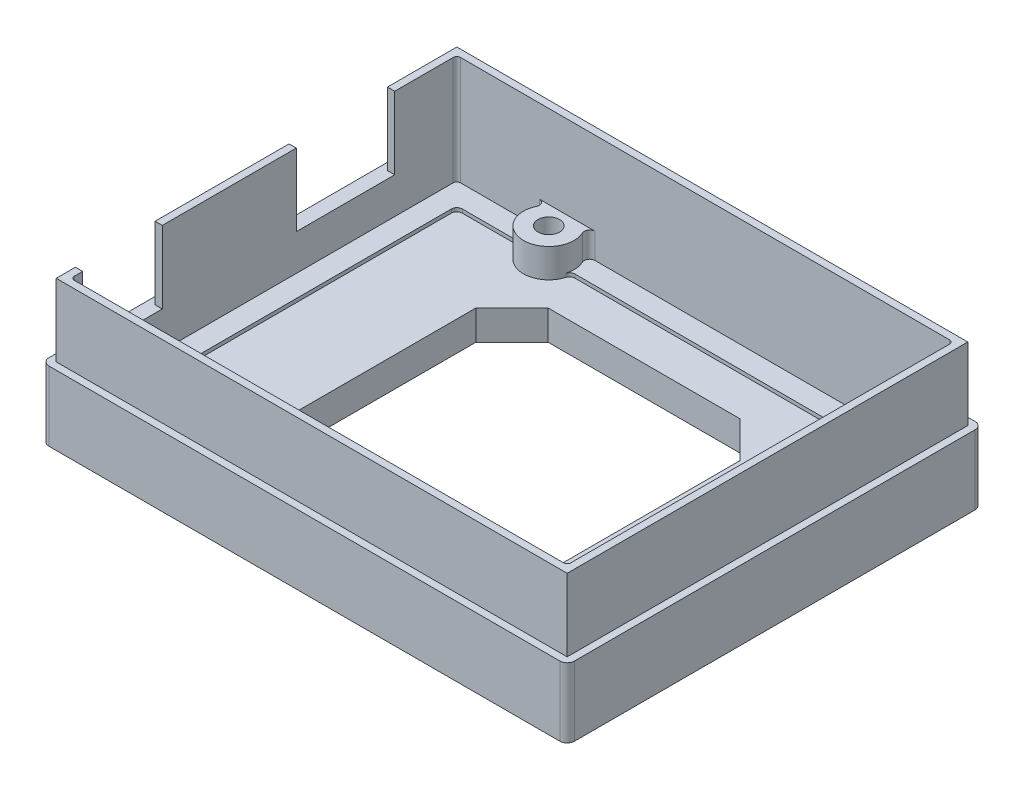
from build123d import *

# Parameters (mm, degrees)
SKETCH1_W                 = 72.58
SKETCH1_H                 = 57.34
SKETCH1_R                 = 1.5
BOSS_EXTRUDE1_DEPTH       = 4.1
SKETCH2_W                 = 72.58
SKETCH2_H                 = 57.34
SKETCH2_R                 = 1.5
BOSS_EXTRUDE2_DEPTH       = 0.5
SKETCH2_4_W               = 72.58
SKETCH2_4_H               = 57.34
SKETCH2_4_R               = 1.5
BOSS_EXTRUDE3_DEPTH       = 4
BOSS_EXTRUDE4_START       = 4
BOSS_EXTRUDE4_OUTLINE_W   = 72.58
BOSS_EXTRUDE4_OUTLINE_H   = 57.34
BOSS_EXTRUDE4_OUTLINE_W_2 = 68.58
BOSS_EXTRUDE4_OUTLINE_H_2 = 53.34
BOSS_EXTRUDE4_DEPTH       = 1.5
SKETCH4_W                 = 70.58
SKETCH4_H                 = 55.34
SKETCH4_W_2               = 68.58
SKETCH4_H_2               = 53.34
BOSS_EXTRUDE5_DEPTH       = 10
FILLET1_R                 = 1
FILLET2_R                 = 0.5
FILLET3_R                 = 0.75
SKETCH3_W                 = 36.5
SKETCH3_H                 = 36.5
CUT_EXTRUDE1_DEPTH        = 51.230399162
SKETCH6_W                 = 11
SKETCH6_H                 = 12
SKETCH6_W_2               = 13.6
SKETCH6_H_2               = 13.6
CUT_EXTRUDE2_DEPTH        = 3
CHAMFER1_SIZE             = 5
SKETCH7_R                 = 3.5
SKETCH7_R_2               = 1.5
CUT_EXTRUDE3_DEPTH        = 3


# Read off the part's stored shape, not the designer's step: Boss-Extrude4
with BuildPart() as part:
    # Sketch1 → Boss-Extrude1 (new body)
    with BuildSketch(Plane(origin=(0, 0, 0), x_dir=(1, 0, 0), z_dir=(0, 1, 0))):
        Rectangle(SKETCH1_W, SKETCH1_H)
        with Locations(Location((-19.05, 24.13, 0), (0, 0, 270))):
            Circle(SKETCH1_R, mode=Mode.SUBTRACT)
        with Locations(Location((31.75, 8.89, 0), (0, 0, 270))):
            Circle(SKETCH1_R, mode=Mode.SUBTRACT)
        with Locations(Location((31.75, -19.05, 0), (0, 0, 270))):
            Circle(SKETCH1_R, mode=Mode.SUBTRACT)
        with Locations(Location((-20.32, -24.13, 0), (0, 0, 270))):
            Circle(SKETCH1_R, mode=Mode.SUBTRACT)
    extrude(amount=BOSS_EXTRUDE1_DEPTH)

    # Sketch2 → Boss-Extrude2 (add)
    with BuildSketch(Plane(origin=(0, 4.1, 0), x_dir=(1, 0, 0), z_dir=(0, 1, 0))):
        Rectangle(SKETCH2_W, SKETCH2_H)
        with BuildLine():
            Line((-31.29, -23.67), (-31.29, 23.67))
            Line((-31.29, 23.67), (-22.519639751, 23.67))
            ThreePointArc((-22.519639751, 23.67), (-19.05, 20.63), (-15.580360249, 23.67))
            Line((-15.580360249, 23.67), (31.29, 23.67))
            Line((31.29, 23.67), (31.29, 12.359639751))
            ThreePointArc((31.29, 12.359639751), (28.25, 8.89), (31.29, 5.420360249))
            Line((31.29, 5.420360249), (31.29, -15.580360249))
            ThreePointArc((31.29, -15.580360249), (28.25, -19.05), (31.29, -22.519639751))
            Line((31.29, -22.519639751), (31.29, -23.67))
            Line((31.29, -23.67), (-16.850360249, -23.67))
            ThreePointArc((-16.850360249, -23.67), (-20.32, -20.63), (-23.789639751, -23.67))
            Line((-23.789639751, -23.67), (-31.29, -23.67))
        make_face(mode=Mode.SUBTRACT)
        with Locations(Location((31.75, 8.89, 0), (0, 0, 270))):
            Circle(SKETCH2_R, mode=Mode.SUBTRACT)
        with Locations(Location((-19.05, 24.13, 0), (0, 0, 270))):
            Circle(SKETCH2_R, mode=Mode.SUBTRACT)
        with Locations(Location((-20.32, -24.13, 0), (0, 0, 270))):
            Circle(SKETCH2_R, mode=Mode.SUBTRACT)
        with Locations(Location((31.75, -19.05, 0), (0, 0, 270))):
            Circle(SKETCH2_R, mode=Mode.SUBTRACT)
    extrude(amount=BOSS_EXTRUDE2_DEPTH)

    # Sketch2<4> → Boss-Extrude3 (add)
    with BuildSketch(Plane(origin=(0, 4.1, 0), x_dir=(1, 0, 0), z_dir=(0, 1, 0))):
        Rectangle(SKETCH2_4_W, SKETCH2_4_H)
        with BuildLine():
            ThreePointArc((-21.457986711, 26.67), (-19.05, 20.63), (-16.642013289, 26.67))
            Line((-16.642013289, 26.67), (34.29, 26.67))
            Line((34.29, 26.67), (34.29, 11.297986711))
            ThreePointArc((34.29, 11.297986711), (28.25, 8.89), (34.29, 6.482013289))
            Line((34.29, 6.482013289), (34.29, -16.642013289))
            ThreePointArc((34.29, -16.642013289), (28.25, -19.05), (34.29, -21.457986711))
            Line((34.29, -21.457986711), (34.29, -26.67))
            Line((34.29, -26.67), (-17.912013289, -26.67))
            ThreePointArc((-17.912013289, -26.67), (-20.32, -20.63), (-22.727986711, -26.67))
            Line((-22.727986711, -26.67), (-34.29, -26.67))
            Line((-34.29, -26.67), (-34.29, 26.67))
            Line((-34.29, 26.67), (-21.457986711, 26.67))
        make_face(mode=Mode.SUBTRACT)
        with Locations(Location((-19.05, 24.13, 0), (0, 0, 270))):
            Circle(SKETCH2_4_R, mode=Mode.SUBTRACT)
        with Locations(Location((-20.32, -24.13, 0), (0, 0, 270))):
            Circle(SKETCH2_4_R, mode=Mode.SUBTRACT)
        with Locations(Location((31.75, -19.05, 0), (0, 0, 270))):
            Circle(SKETCH2_4_R, mode=Mode.SUBTRACT)
        with Locations(Location((31.75, 8.89, 0), (0, 0, 270))):
            Circle(SKETCH2_4_R, mode=Mode.SUBTRACT)
    extrude(amount=BOSS_EXTRUDE3_DEPTH)

    # Boss-Extrude4 outline → Boss-Extrude4 (add)
    with BuildSketch(Plane(origin=(0, 4.1, 0), x_dir=(1, 0, 0), z_dir=(0, 1, 0)).offset(BOSS_EXTRUDE4_START)):
        Rectangle(BOSS_EXTRUDE4_OUTLINE_W, BOSS_EXTRUDE4_OUTLINE_H)
        Rectangle(BOSS_EXTRUDE4_OUTLINE_W_2, BOSS_EXTRUDE4_OUTLINE_H_2, mode=Mode.SUBTRACT)
    extrude(amount=BOSS_EXTRUDE4_DEPTH)

    # Sketch4 → Boss-Extrude5 (add)
    with BuildSketch(Plane(origin=(0, 9.6, 0), x_dir=(1, 0, 0), z_dir=(0, 1, 0))):
        Rectangle(SKETCH4_W, SKETCH4_H)
        Rectangle(SKETCH4_W_2, SKETCH4_H_2, mode=Mode.SUBTRACT)
    extrude(amount=BOSS_EXTRUDE5_DEPTH)

    # Fillet1
    fillet1_edges = [part.edges().sort_by_distance(p)[0] for p in [
        (36.29, 4.8, -28.67),
        (36.29, 4.8, 28.67),
        (-36.29, 4.8, 28.67),
        (-36.29, 4.8, -28.67),
    ]]
    fillet(fillet1_edges, radius=FILLET1_R)

    # Fillet2
    fillet2_edges = [part.edges().sort_by_distance(p)[0] for p in [
        (34.29, 12.1, 26.67),
        (-34.29, 12.1, 26.67),
        (-34.29, 12.1, -26.67),
        (34.29, 12.1, -26.67),
    ]]
    fillet(fillet2_edges, radius=FILLET2_R)

    # Fillet3
    # the kernel refuses this fillet: 0.75 mm, written as the material it adds along each edge
    with BuildSketch(Plane(origin=(-17.912013289, 0.983317982, 26.67), x_dir=(1, 0, 0), z_dir=(0, 1, 0)), Plane(origin=(-21.457986711, 0.983317982, -26.67), x_dir=(-1, 0, 0), z_dir=(0, 1, 0)), Plane(origin=(34.29, 0.983317982, -11.297986711), x_dir=(0, 0, -1), z_dir=(0, 1, 0)), Plane(origin=(34.29, 0.983317982, 16.642013289), x_dir=(0, 0, -1), z_dir=(0, 1, 0))) as fillet3_piece_1:
        with BuildLine():
            CenterArc((1.446672807, 0.75), FILLET3_R, 155.091114703, 114.908885297)
            ThreePointArc((0.766438775, 1.065882353), (0.433642713, 0.496683524), (0, 0))
            Line((0, 0), (1.446672807, 0))
        make_face()
    extrude(amount=7.116682018)
    with BuildSketch(Plane(origin=(-22.727986711, 0.983317982, 26.67), x_dir=(-1, 0, 0), z_dir=(0, 1, 0)), Plane(origin=(-16.642013289, 0.983317982, -26.67), x_dir=(1, 0, 0), z_dir=(0, 1, 0)), Plane(origin=(34.29, 0.983317982, -6.482013289), x_dir=(0, 0, 1), z_dir=(0, 1, 0)), Plane(origin=(34.29, 0.983317982, 21.457986711), x_dir=(0, 0, 1), z_dir=(0, 1, 0))) as fillet3_piece_2:
        with BuildLine():
            CenterArc((1.446672807, -0.75), FILLET3_R, 90, 114.908885297)
            ThreePointArc((0.766438775, -1.065882353), (0.433642713, -0.496683524), (0, 0))
            Line((0, 0), (1.446672807, 0))
        make_face()
    extrude(amount=7.116682018)
    with BuildSketch(Plane(origin=(31.29, 2.225, -23.67), x_dir=(-1, 0, 0), z_dir=(0, 1, 0)), Plane(origin=(31.29, 2.225, 23.67), x_dir=(0, 0, -1), z_dir=(0, 1, 0)), Plane(origin=(-31.29, 2.225, 23.67), x_dir=(1, 0, 0), z_dir=(0, 1, 0)), Plane(origin=(-31.29, 2.225, -23.67), x_dir=(0, 0, 1), z_dir=(0, 1, 0))) as fillet3_piece_3:
        with BuildLine():
            CenterArc((FILLET3_R, FILLET3_R), FILLET3_R, 180, 90)
            Line((0, FILLET3_R), (0, 0))
            Line((0, 0), (FILLET3_R, 0))
        make_face()
    extrude(amount=2.375)
    with BuildSketch(Plane(origin=(31.29, 2.588815876, -12.359639751), x_dir=(-0.977977776437884, 0, 0.20870905297473832), z_dir=(0, 1, 0)), Plane(origin=(31.29, 2.588815876, 15.580360249), x_dir=(-0.9779777764378829, 0, 0.2087090529747441), z_dir=(0, 1, 0)), Plane(origin=(-16.850360249, 2.588815876, 23.67), x_dir=(-0.2087090529747233, 0, -0.9779777764378872), z_dir=(0, 1, 0)), Plane(origin=(-22.519639751, 2.588815876, -23.67), x_dir=(0.20870905297473083, 0, 0.9779777764378856), z_dir=(0, 1, 0))) as fillet3_piece_4:
        with BuildLine():
            CenterArc((0.607324209, -0.747693586), FILLET3_R, 94.494558388, 73.458731432)
            Line((-0.126159123, -0.591161796), (0, 0))
            ThreePointArc((0, 0), (0.274275449, -0.010763267), (0.548550899, 0))
        make_face()
    extrude(amount=2.011184124)
    with BuildSketch(Plane(origin=(31.29, 2.588815876, -5.420360249), x_dir=(-0.9779777764378846, 0, -0.20870905297473547), z_dir=(0, 1, 0)), Plane(origin=(31.29, 2.588815876, 22.519639751), x_dir=(-0.9779777764378821, 0, -0.20870905297474715), z_dir=(0, 1, 0)), Plane(origin=(-23.789639751, 2.588815876, 23.67), x_dir=(0.20870905297472817, 0, -0.9779777764378861), z_dir=(0, 1, 0)), Plane(origin=(-15.580360249, 2.588815876, -23.67), x_dir=(-0.2087090529747233, 0, 0.9779777764378872), z_dir=(0, 1, 0))) as fillet3_piece_5:
        with BuildLine():
            CenterArc((0.607324209, 0.747693586), FILLET3_R, 192.04671018, 73.458731432)
            Line((-0.126159123, 0.591161796), (0, 0))
            ThreePointArc((0, 0), (0.274275449, 0.010763267), (0.548550899, 0))
        make_face()
    extrude(amount=2.011184124)

    # Sketch3 → Cut-Extrude1 (cut, through all)
    with BuildSketch(Plane(origin=(0, 0, 0), x_dir=(1, 0, 0), z_dir=(0, 1, 0))):
        Rectangle(SKETCH3_W, SKETCH3_H)
    extrude(amount=CUT_EXTRUDE1_DEPTH, mode=Mode.SUBTRACT)

    # Sketch6 → Cut-Extrude2 (cut)
    with BuildSketch(Plane.ZY.offset(35.29)):
        with Locations((19.52, 15.6)):
            Rectangle(SKETCH6_W, SKETCH6_H)
        with Locations((-11.29, 16.4)):
            Rectangle(SKETCH6_W_2, SKETCH6_H_2)
    extrude(amount=-CUT_EXTRUDE2_DEPTH, mode=Mode.SUBTRACT)

    # Chamfer1
    chamfer1_edges = [part.edges().sort_by_distance(p)[0] for p in [
        (18.25, 2.05, 18.25),
        (18.25, 2.05, -18.25),
        (-18.25, 2.05, -18.25),
        (-18.25, 2.05, 18.25),
    ]]
    chamfer(chamfer1_edges, length=CHAMFER1_SIZE)

    # Sketch7 → Cut-Extrude3 (cut)
    # profile 1 of 4: a face of its own
    with BuildSketch(Plane.XZ):
        with Locations(Location((-20.32, 24.13, 0), (0, 0, 270))):
            Circle(SKETCH7_R)
        with Locations(Location((-20.32, 24.13, 0), (0, 0, 270))):
            Circle(SKETCH7_R_2, mode=Mode.SUBTRACT)
    # profile 2 of 4: a face of its own
    with BuildSketch(Plane.XZ):
        with Locations(Location((-19.05, -24.13, 0), (0, 0, 270))):
            Circle(SKETCH7_R)
        with Locations(Location((-19.05, -24.13, 0), (0, 0, 270))):
            Circle(SKETCH7_R_2, mode=Mode.SUBTRACT)
    # profile 3 of 4: a face of its own
    with BuildSketch(Plane.XZ):
        with Locations(Location((31.75, -8.89, 0), (0, 0, 270))):
            Circle(SKETCH7_R)
        with Locations(Location((31.75, -8.89, 0), (0, 0, 270))):
            Circle(SKETCH7_R_2, mode=Mode.SUBTRACT)
    # profile 4 of 4: a face of its own
    with BuildSketch(Plane.XZ):
        with Locations(Location((31.75, 19.05, 0), (0, 0, 270))):
            Circle(SKETCH7_R)
        with Locations(Location((31.75, 19.05, 0), (0, 0, 270))):
            Circle(SKETCH7_R_2, mode=Mode.SUBTRACT)
    extrude(amount=-CUT_EXTRUDE3_DEPTH, mode=Mode.SUBTRACT)


solid = part.part
